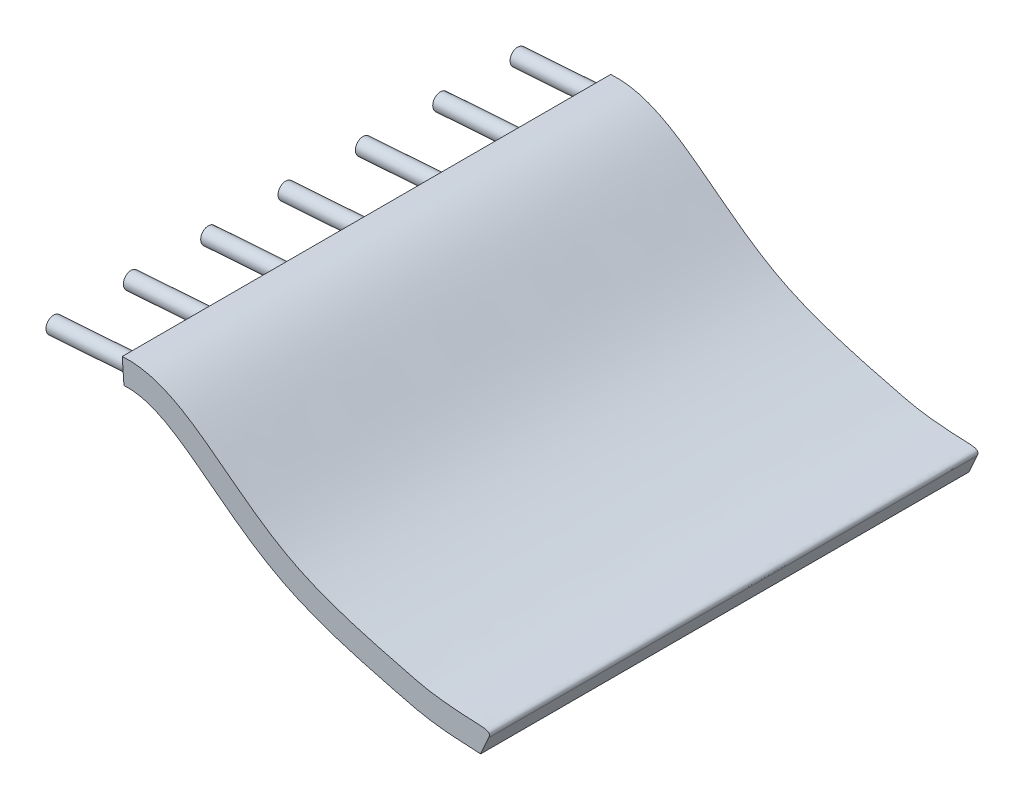
from build123d import *

# Parameters (mm, degrees)
EXTRUDE_1_DEPTH   = 120
SKETCH_3_R        = 2
EXTRUDE_1_2_DEPTH = 20


# Read off the part's stored shape, not the designer's step: 拉伸-薄壁1
with BuildPart() as part:
    # Extrude 1 outline → Extrude 1 (new body)
    with BuildSketch(Plane.XY):
        with BuildLine():
            Line((-90, 35), (-89.578271107, 29.014839623))
            add(Edge.make_bspline(
                [(-89.578271107, 29.014839623), (-88.578874571, 29.085259523), (-87.574889593, 29.048858893), (-85.592350242, 28.776203967), (-84.615701854, 28.541183309), (-81.760027281, 27.616018756), (-79.958318561, 26.715014824), (-76.512874957, 24.678318893), (-74.865166107, 23.537951956), (-71.629088076, 21.182742641), (-70.037348112, 19.969475657), (-65.265700573, 16.326042299), (-62.089293712, 13.88629703), (-57.115339555, 10.524302545), (-55.423627222, 9.452876869), (-51.957946298, 7.450811016), (-50.183291101, 6.5217753), (-44.744015376, 3.980612877), (-40.984072011, 2.585084421), (-33.368905969, 0.118083424), (-29.508228436, -0.945331912), (-24.664264106, -2.196742408), (-23.69430338, -2.443417589), (-21.7547503, -2.936303819), (-20.786197835, -3.186667183), (-18.843337423, -3.666350834), (-17.868332339, -3.892277695), (-15.90680944, -4.288801215), (-14.920529134, -4.459608803), (-11.95039781, -4.894495725), (-9.956696951, -5.083820355), (-6.962294502, -5.294440132), (-5.964296689, -5.352062276), (-4.715054663, -5.413466901), (-4.460377342, -5.42542648), (-4.085530854, -5.442277748), (-3.960555017, -5.44777159), (-3.710635988, -5.458519853), (-3.591591353, -5.46352797), (-3.341653054, -5.473818413), (-3.221501066, -5.478664365), (-2.971544382, -5.488498109), (-2.839527208, -5.493494838), (-2.589581836, -5.503612046), (-2.464678275, -5.509016079), (-2.277353095, -5.519395903), (-2.214897658, -5.523189562), (-2.121344789, -5.530079886), (-2.090269007, -5.532615341), (-2.043568315, -5.536968425), (-2.028009822, -5.538504155), (-2.004687692, -5.540964692), (-1.99691268, -5.541811421), (-1.985261446, -5.543131556), (-1.981338307, -5.543584738), (-1.975516121, -5.54427441), (-1.973563741, -5.544508553), (-1.970251448, -5.544912396), (-1.966950162, -5.545389755), (-1.965815411, -5.54552444)],
                knots=[0, 0, 0, 0, 0.003001801, 0.003001801, 0.006003601, 0.006003601, 0.012007202, 0.012007202, 0.018010803, 0.018010803, 0.024014405, 0.024014405, 0.036021607, 0.036021607, 0.042025208, 0.042025208, 0.048028809, 0.048028809, 0.060036012, 0.060036012, 0.072043214, 0.072043214, 0.075045014, 0.075045014, 0.078046815, 0.078046815, 0.081048616, 0.081048616, 0.084050416, 0.084050416, 0.090054017, 0.090054017, 0.093055818, 0.093055818, 0.093806268, 0.093806268, 0.094181493, 0.094181493, 0.094556718, 0.094556718, 0.094931943, 0.094931943, 0.095307168, 0.095307168, 0.095682393, 0.095682393, 0.095870006, 0.095870006, 0.095963812, 0.095963812, 0.096010715, 0.096010715, 0.096034167, 0.096034167, 0.096045893, 0.096045893, 0.096051756, 0.096051756, 0.096055903, 0.096055903, 0.096055903, 0.096055903], degree=3))
            Line((-1.965815411, -5.54552444), (0, -1.138987092))
            add(Edge.make_bspline(
                [(-90, 35), (-81.70628867, 35.584394983), (-67.196239938, 25.959913143), (-48.174565102, 9.790984398), (-20.258178644, 2.940369417), (-12.131843338, 0.752448898), (0.865152012, 0.38749064), (0, -1.138987092)],
                knots=[0, 0, 0, 0, 0.239479743, 0.499707743, 0.781902407, 0.967873304, 1, 1, 1, 1], degree=3))
        make_face()
    extrude(amount=EXTRUDE_1_DEPTH)

    # 草图3 → Extrude 1 2 (add)
    with BuildSketch(Plane(origin=(-87.101361099, -6.137372816, 0), x_dir=(0, 0, 1), z_dir=(-0.9975267295328711, -0.07028814884071229, 0))):
        with Locations(Location((60, 38.011313019, 0), (0, 0, 270))):
            Circle(SKETCH_3_R)
        with Locations(Location((79, 38.011313019, 0), (0, 0, 270))):
            Circle(SKETCH_3_R)
        with Locations(Location((98, 38.011313019, 0), (0, 0, 270))):
            Circle(SKETCH_3_R)
        with Locations(Location((117, 38.011313019, 0), (0, 0, 270))):
            Circle(SKETCH_3_R)
        with Locations(Location((3, 38.011313019, 0), (0, 0, 270))):
            Circle(SKETCH_3_R)
        with Locations(Location((22, 38.011313019, 0), (0, 0, 270))):
            Circle(SKETCH_3_R)
        with Locations(Location((41, 38.011313019, 0), (0, 0, 270))):
            Circle(SKETCH_3_R)
    extrude(amount=EXTRUDE_1_2_DEPTH)


solid = part.part
